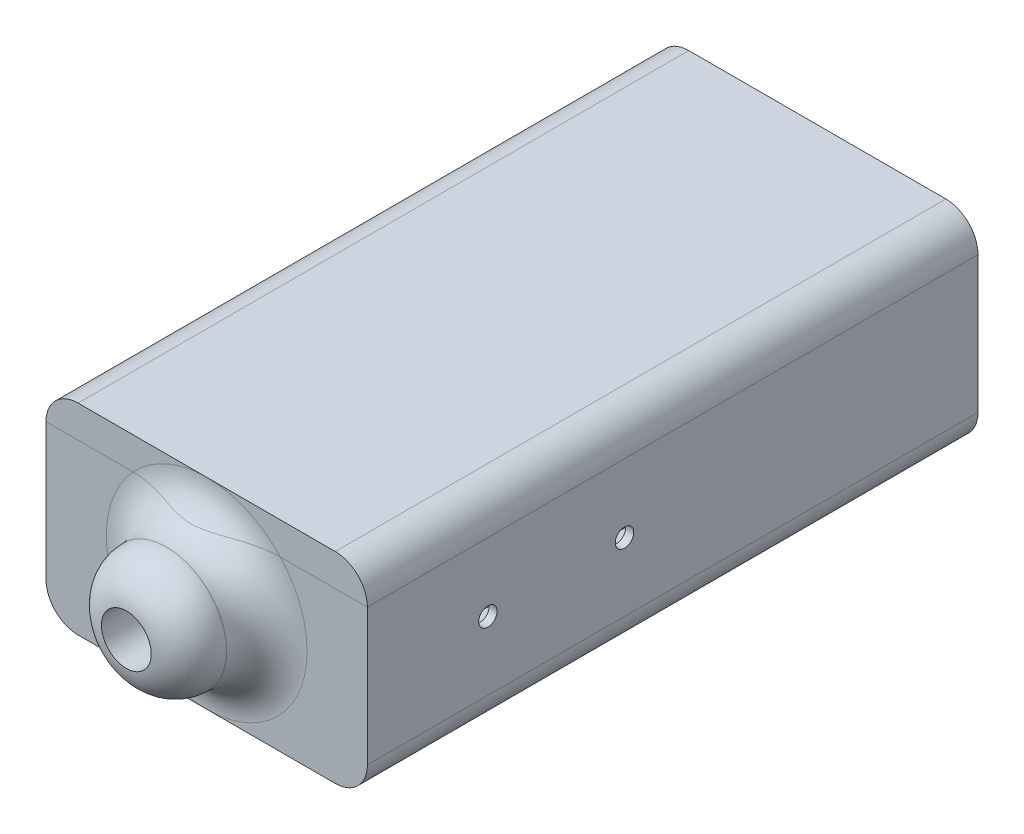
from build123d import *

# Parameters (mm, degrees)
SKETCH1_W              = 40
SKETCH1_H              = 25
SKETCH1_R              = 2
BOSS_EXTRUDE1_DEPTH    = 1
SKETCH2_W              = 40
SKETCH2_H              = 25
SKETCH2_W_2            = 38
SKETCH2_H_2            = 23
BOSS_EXTRUDE2_DEPTH    = 75
FILLET2_R              = 4
SKETCH4_R              = 7.5
SKETCH4_R_2            = 3.1
BOSS_EXTRUDE3_DEPTH    = 10
FILLET3_R              = 5
SKETCH5_R              = 1.15
CUT_EXTRUDE1_DEPTH     = 87.788536109
SKETCH10_W             = 22.476776695
SKETCH10_H             = 7.4
SKETCH10_H_2           = 15.101776695
BOSS_EXTRUDE4_DEPTH    = 6
SKETCH12_W             = 2.5
SKETCH12_H             = 4.858493649
BOSS_EXTRUDE5_DEPTH    = 15
SKETCH13_R             = 1.35
CUT_EXTRUDE3_DEPTH     = 12
SKETCH15_W             = 5
SKETCH15_H             = 6
BOSS_EXTRUDE6_DEPTH    = 14
SKETCH16_R             = 1.25
CUT_EXTRUDE4_DEPTH     = 5
SPLIT1_SURFACE_1_BACK  = 99.087
SPLIT1_SURFACE_1_DEPTH = 198.174
SPLIT1_SURFACE_2_BACK  = 99.087
SPLIT1_SURFACE_2_DEPTH = 198.174


with BuildPart() as part:
    # Sketch1 → Boss-Extrude1 (new body)
    with BuildSketch(Plane.XY):
        Rectangle(SKETCH1_W, SKETCH1_H)
        Circle(SKETCH1_R, mode=Mode.SUBTRACT)
    extrude(amount=-BOSS_EXTRUDE1_DEPTH)

    # Sketch2 → Boss-Extrude2 (add)
    with BuildSketch(Plane(origin=(0, 0, -1), x_dir=(-1, 0, 0), z_dir=(0, 0, -1))):
        Rectangle(SKETCH2_W, SKETCH2_H)
        Rectangle(SKETCH2_W_2, SKETCH2_H_2, mode=Mode.SUBTRACT)
    extrude(amount=BOSS_EXTRUDE2_DEPTH)

    # Fillet2
    fillet2_edges = [part.edges().sort_by_distance(p)[0] for p in [
        (-19, 11.5, -38.5),
        (19, 11.5, -38.5),
        (19, -11.5, -38.5),
        (-19, -11.5, -38.5),
        (20, -12.5, -38),
        (-20, -12.5, -38),
        (-20, 12.5, -38),
        (20, 12.5, -38),
    ]]
    fillet(fillet2_edges, radius=FILLET2_R)

    # Sketch4 → Boss-Extrude3 (add)
    with BuildSketch(Plane.XY):
        Circle(SKETCH4_R)
        Circle(SKETCH4_R_2, mode=Mode.SUBTRACT)
    extrude(amount=BOSS_EXTRUDE3_DEPTH)

    # Fillet3
    # the kernel refuses this fillet: 5 mm, written as the material it adds along each edge
    with BuildSketch(Plane(origin=(0, 0, 0), x_dir=(1, 0, 0), z_dir=(0, -1, 0))) as fillet3_piece_1:
        with BuildLine():
            CenterArc((7.5 + FILLET3_R, FILLET3_R), FILLET3_R, 180, 90)
            Line((7.5, FILLET3_R), (7.5, 0))
            Line((7.5, 0), (7.5 + FILLET3_R, 0))
        make_face()
    revolve(axis=Axis((0, 0, 0), (0, 0, 1)))
    # the kernel refuses this fillet: 5 mm, written as the material it takes off along each edge
    with BuildSketch(Plane(origin=(0, 0, 10), x_dir=(1, 0, 0), z_dir=(0, -1, 0))) as fillet3_2_piece_1:
        with BuildLine():
            CenterArc((2.5, -4.963869458), FILLET3_R, 0, 83.107897421)
            Line((3.1, 0), (7.5, 0))
            Line((7.5, 0), (7.5, -4.963869458))
        make_face()
    revolve(axis=Axis((0, 0, 10), (0, 0, 1)), mode=Mode.SUBTRACT)

    # Sketch5 → Cut-Extrude1 (cut, through all)
    with BuildSketch(Plane(origin=(20, 0, 0), x_dir=(0, 0, -1), z_dir=(1, 0, 0))):
        with Locations((15, 0)):
            Circle(SKETCH5_R)
        with Locations((32, 0)):
            Circle(SKETCH5_R)
    extrude(amount=-CUT_EXTRUDE1_DEPTH, mode=Mode.SUBTRACT)

    # Sketch10 → Boss-Extrude4 (add)
    with BuildSketch(Plane(origin=(0, -11.5, 0), x_dir=(1, 0, 0), z_dir=(0, 1, 0))):
        with Locations((-3.761611653, 28.8)):
            Rectangle(SKETCH10_W, SKETCH10_H)
        with Locations((-3.761611653, 40.050888348)):
            Rectangle(SKETCH10_W, SKETCH10_H_2)
    extrude(amount=BOSS_EXTRUDE4_DEPTH)

    # Sketch12 → Boss-Extrude5 (add)
    with BuildSketch(Plane(origin=(0, -11.5, 0), x_dir=(1, 0, 0), z_dir=(0, 1, 0))):
        with Locations((2.076776695, 50.045753176)):
            Rectangle(SKETCH12_W, SKETCH12_H)
        Polygon((3.326776695, 25.133493649), (0.826776695, 25.133493649), (0.826776695, 20.289638402), (3.326776695, 20.275), align=None)
    extrude(amount=BOSS_EXTRUDE5_DEPTH)

    # Sketch13 → Cut-Extrude3 (cut)
    with BuildSketch(Plane(origin=(3.326776695, 0, 0), x_dir=(0, 0, -1), z_dir=(1, 0, 0))):
        with Locations((22.704246825, 0)):
            Circle(SKETCH13_R)
        with Locations((50.045753175, 0)):
            Circle(SKETCH13_R)
    extrude(amount=-CUT_EXTRUDE3_DEPTH, mode=Mode.SUBTRACT)

    # Sketch15 → Boss-Extrude6 (add)
    with BuildSketch(Plane(origin=(0, -11.5, 0), x_dir=(1, 0, 0), z_dir=(0, 1, 0))):
        with Locations((11.5, 15)):
            Rectangle(SKETCH15_W, SKETCH15_H)
    extrude(amount=BOSS_EXTRUDE6_DEPTH)

    # Sketch16 → Cut-Extrude4 (cut)
    with BuildSketch(Plane(origin=(14, 0, 0), x_dir=(0, 0, -1), z_dir=(1, 0, 0))):
        with Locations((15, 0)):
            Circle(SKETCH16_R)
    extrude(amount=-CUT_EXTRUDE4_DEPTH, mode=Mode.SUBTRACT)


with BuildPart() as body_2:
    # Split1: the piece behind the surface
    add(part.part)
    # Split1 surface: a surface, the sketch's curves swept straight by 198.174 mm
    with BuildLine(Plane(origin=(0, 0, -76), x_dir=(-1, 0, 0), z_dir=(0, 0, -1)).offset(-SPLIT1_SURFACE_1_BACK), mode=Mode.PRIVATE) as split1_surface_1_path:
        Line((20, 8.5), (-20, 8.5))
    split1_surface_1 = Shell.extrude(split1_surface_1_path.wire(), (0 * SPLIT1_SURFACE_1_DEPTH, 0 * SPLIT1_SURFACE_1_DEPTH, -1 * SPLIT1_SURFACE_1_DEPTH))
    split(bisect_by=split1_surface_1, keep=Keep.BOTTOM)


with BuildPart() as part_1:
    add(part.part)

    # Split1: split by a surface, the side it looks to stays
    # Split1 surface: a surface, the sketch's curves swept straight by 198.174 mm
    with BuildLine(Plane(origin=(0, 0, -76), x_dir=(-1, 0, 0), z_dir=(0, 0, -1)).offset(-SPLIT1_SURFACE_2_BACK), mode=Mode.PRIVATE) as split1_surface_2_path:
        Line((20, 8.5), (-20, 8.5))
    split1_surface_2 = Shell.extrude(split1_surface_2_path.wire(), (0 * SPLIT1_SURFACE_2_DEPTH, 0 * SPLIT1_SURFACE_2_DEPTH, -1 * SPLIT1_SURFACE_2_DEPTH))
    split(bisect_by=split1_surface_2, keep=Keep.TOP)


solid = Compound([body_2.part, part_1.part])
